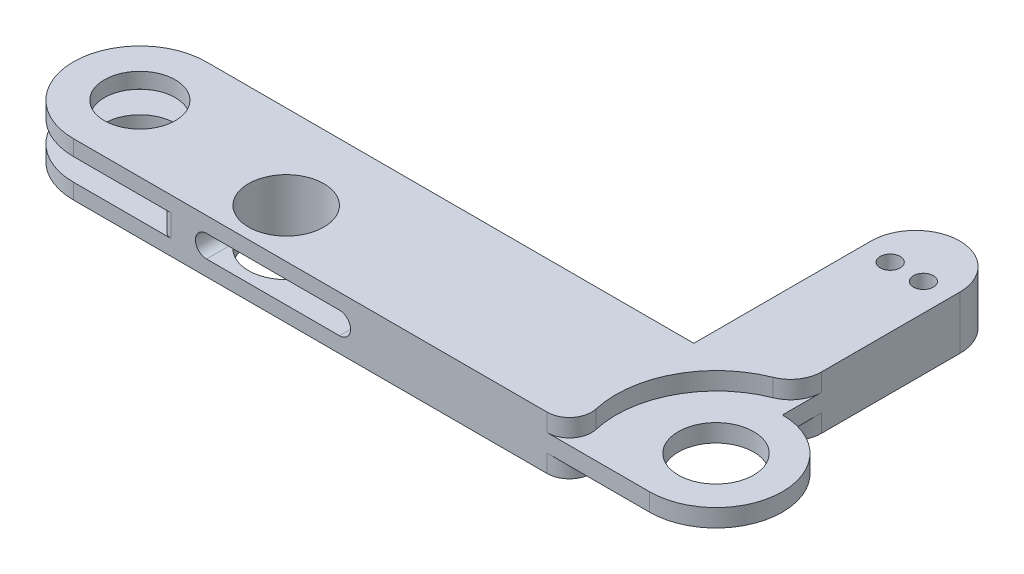
from build123d import *

# Parameters (mm, degrees)
SKETCH1_R           = 8
BOSS_EXTRUDE1_DEPTH = 12
SKETCH3_W           = 35
SKETCH3_H           = 5
CUT_EXTRUDE1_DEPTH  = 30
SKETCH4_W           = 20
SKETCH4_H           = 50
BOSS_EXTRUDE2_DEPTH = 12
FILLET1_R           = 10
FILLET2_R           = 10
SKETCH7_R           = 8.5
CUT_EXTRUDE4_DEPTH  = 12
SKETCH8_R           = 22.712934263
CUT_EXTRUDE5_DEPTH  = 4
CUT_EXTRUDE6_START  = -4
SKETCH9_R           = 22.712934263
CUT_EXTRUDE6_DEPTH  = 4
SKETCH14_R          = 2.25
CUT_EXTRUDE7_DEPTH  = 12
FILLET3_R           = 5
FILLET4_R           = 5
SKETCH15_R          = 8.5
CUT_EXTRUDE8_DEPTH  = 12
CUT_EXTRUDE9_DEPTH  = 7
CHAMFER1_START      = 3.5
CHAMFER1_DEPTH      = 5
FILLET6_R           = 7
FILLET7_R           = 7
FILLET9_R           = 2
FILLET10_R          = 2


with BuildPart() as part:
    # Sketch1 → Boss-Extrude1 (new body)
    with BuildSketch(Plane(origin=(0, 0, 0), x_dir=(1, 0, 0), z_dir=(0, 1, 0))):
        with BuildLine():
            Line((0, 15), (130, 15))
            ThreePointArc((130, 15), (145, 0), (130, -15))
            Line((130, -15), (0, -15))
            ThreePointArc((0, -15), (-15, 0), (0, 15))
        make_face()
        with Locations(Location((0, 0, 0), (0, 0, 270))):
            Circle(SKETCH1_R, mode=Mode.SUBTRACT)
    extrude(amount=BOSS_EXTRUDE1_DEPTH)

    # Sketch3 → Cut-Extrude1 (cut)
    with BuildSketch(Plane(origin=(0, 0, -15), x_dir=(-1, 0, 0), z_dir=(0, 0, -1))):
        with Locations((-2.5, 6)):
            Rectangle(SKETCH3_W, SKETCH3_H)
    extrude(amount=-CUT_EXTRUDE1_DEPTH, mode=Mode.SUBTRACT)

    # Sketch4 → Boss-Extrude2 (add)
    with BuildSketch(Plane.XZ):
        with Locations((120, -40)):
            Rectangle(SKETCH4_W, SKETCH4_H)
    extrude(amount=-BOSS_EXTRUDE2_DEPTH)

    # Fillet1
    fillet1_edges = [part.edges().sort_by_distance(p)[0] for p in [
        (110, 6, -65),
    ]]
    fillet(fillet1_edges, radius=FILLET1_R)

    # Fillet2
    fillet2_edges = [part.edges().sort_by_distance(p)[0] for p in [
        (130, 6, -65),
    ]]
    fillet(fillet2_edges, radius=FILLET2_R - 0.0001)  # a hair under: the kernel refuses the full size

    # Sketch7 → Cut-Extrude4 (cut)
    with BuildSketch(Plane.XZ):
        with Locations(Location((130, 0, 0), (0, 0, 270))):
            Circle(SKETCH7_R)
    extrude(amount=-CUT_EXTRUDE4_DEPTH, mode=Mode.SUBTRACT)

    # Sketch8 → Cut-Extrude5 (cut)
    with BuildSketch(Plane(origin=(0, 12, 0), x_dir=(1, 0, 0), z_dir=(0, 1, 0))):
        with Locations((133.938996952, -3.822545113)):
            Circle(SKETCH8_R)
    extrude(amount=-CUT_EXTRUDE5_DEPTH, mode=Mode.SUBTRACT)

    # Sketch9 → Cut-Extrude6 (cut)
    with BuildSketch(Plane.XZ.offset(CUT_EXTRUDE6_START)):
        with Locations((133.938996952, 3.822545113)):
            Circle(SKETCH9_R)
    extrude(amount=CUT_EXTRUDE6_DEPTH, mode=Mode.SUBTRACT)

    # Sketch14 → Cut-Extrude7 (cut)
    with BuildSketch(Plane.XZ):
        with Locations(Location((116.3, -53, 0), (0, 0, 270))):
            Circle(SKETCH14_R)
        with Locations(Location((123.8, -53, 0), (0, 0, 270))):
            Circle(SKETCH14_R)
    extrude(amount=-CUT_EXTRUDE7_DEPTH, mode=Mode.SUBTRACT)

    # Fillet3
    fillet3_edges = [part.edges().sort_by_distance(p)[0] for p in [
        (114.166746572, 10, 15),
    ]]
    fillet(fillet3_edges, radius=FILLET3_R)

    # Fillet4
    fillet4_edges = [part.edges().sort_by_distance(p)[0] for p in [
        (114.166746572, 2, 15),
    ]]
    fillet(fillet4_edges, radius=FILLET4_R)

    # Sketch15 → Cut-Extrude8 (cut)
    with BuildSketch(Plane.XZ):
        with Locations(Location((37.060545973, 4.039960241, 0), (0, 0, 270))):
            Circle(SKETCH15_R)
    extrude(amount=-CUT_EXTRUDE8_DEPTH, mode=Mode.SUBTRACT)

    # Sketch16 → Cut-Extrude9 (cut)
    with BuildSketch(Plane.XY.offset(15)):
        with BuildLine():
            Line((60.046424392, 3.5), (30.046424392, 3.5))
            ThreePointArc((30.046424392, 3.5), (27.546424392, 6), (30.046424392, 8.5))
            Line((30.046424392, 8.5), (60.046424392, 8.5))
            ThreePointArc((60.046424392, 8.5), (62.546424392, 6), (60.046424392, 3.5))
        make_face()
    extrude(amount=-CUT_EXTRUDE9_DEPTH, mode=Mode.SUBTRACT)

    # Chamfer1: read off the stored shape, not the designer's step
    # Chamfer1 outline → Chamfer1 (cut)
    with BuildSketch(Plane(origin=(0, 0, 0), x_dir=(1, 0, 0), z_dir=(0, 1, 0)).offset(CHAMFER1_START)):
        with BuildLine():
            Line((44.581721752, -8), (54.625922679, -8))
            Line((54.625922679, -8), (45.554566675, -3.721193369))
            ThreePointArc((45.554566675, -3.721193369), (45.349012425, -5.924455895), (44.581721752, -8))
        make_face()
    extrude(amount=CHAMFER1_DEPTH, mode=Mode.SUBTRACT)

    # Fillet6
    fillet6_edges = [part.edges().sort_by_distance(p)[0] for p in [
        (130, 2, -18.546220742),
    ]]
    fillet(fillet6_edges, radius=FILLET6_R)

    # Fillet7
    fillet7_edges = [part.edges().sort_by_distance(p)[0] for p in [
        (130, 10, -18.546220742),
    ]]
    fillet(fillet7_edges, radius=FILLET7_R)

    # Fillet9
    fillet9_edges = [part.edges().sort_by_distance(p)[0] for p in [
        (20, 6, -15),
    ]]
    fillet(fillet9_edges, radius=FILLET9_R)

    # Fillet10
    fillet10_edges = [part.edges().sort_by_distance(p)[0] for p in [
        (20, 6, 15),
    ]]
    fillet(fillet10_edges, radius=FILLET10_R)


solid = part.part
